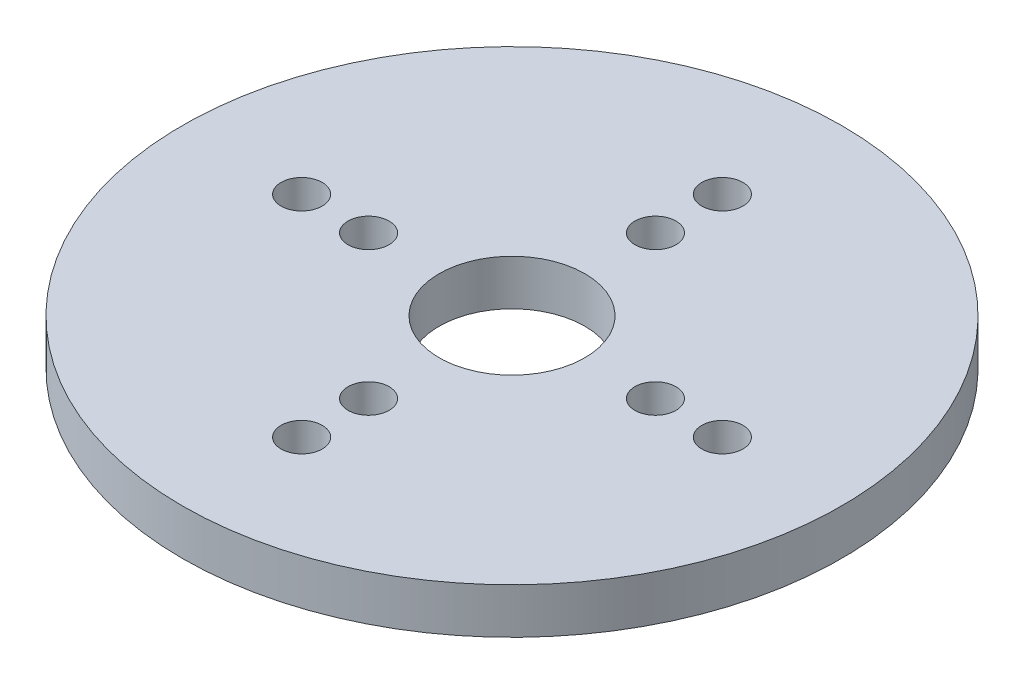
from build123d import *

# Parameters (mm, degrees)
SKETCH1_R           = 34.464858416
SKETCH1_R_2         = 2.15
BOSS_EXTRUDE1_DEPTH = 4.7625


with BuildPart() as part:
    # Sketch1 → Boss-Extrude1 (new body)
    with BuildSketch(Plane(origin=(0, 0, 0), x_dir=(1, 0, 0), z_dir=(0, 1, 0))):
        with Locations((0, -8.264651725)):
            Circle(SKETCH1_R)
        with BuildLine():
            ThreePointArc((0, -32.414651725), (-2.15, -30.264651725), (0, -28.114651725))
            ThreePointArc((0, -28.114651725), (1.52027958, -28.744372146), (2.15, -30.264651725))
            ThreePointArc((2.15, -30.264651725), (1.52027958, -31.784931305), (0, -32.414651725))
        make_face(mode=Mode.SUBTRACT)
        with BuildLine():
            ThreePointArc((0, -25.414651725), (-2.15, -23.264651725), (0, -21.114651725))
            ThreePointArc((0, -21.114651725), (1.52027958, -21.744372146), (2.15, -23.264651725))
            ThreePointArc((2.15, -23.264651725), (1.52027958, -24.784931305), (0, -25.414651725))
        make_face(mode=Mode.SUBTRACT)
        with Locations((-22, -8.264651725)):
            Circle(SKETCH1_R_2, mode=Mode.SUBTRACT)
        with Locations((-15, -8.264651725)):
            Circle(SKETCH1_R_2, mode=Mode.SUBTRACT)
        with BuildLine():
            ThreePointArc((7.62, -8.264651725), (5.388153673, -13.652805398), (0, -15.884651725))
            ThreePointArc((0, -15.884651725), (-5.388153673, -2.876498053), (7.62, -8.264651725))
        make_face(mode=Mode.SUBTRACT)
        with Locations((15, -8.264651725)):
            Circle(SKETCH1_R_2, mode=Mode.SUBTRACT)
        with Locations((0, 6.735348275)):
            Circle(SKETCH1_R_2, mode=Mode.SUBTRACT)
        with Locations((22, -8.264651725)):
            Circle(SKETCH1_R_2, mode=Mode.SUBTRACT)
        with Locations((0, 13.735348275)):
            Circle(SKETCH1_R_2, mode=Mode.SUBTRACT)
    extrude(amount=BOSS_EXTRUDE1_DEPTH)


solid = part.part
